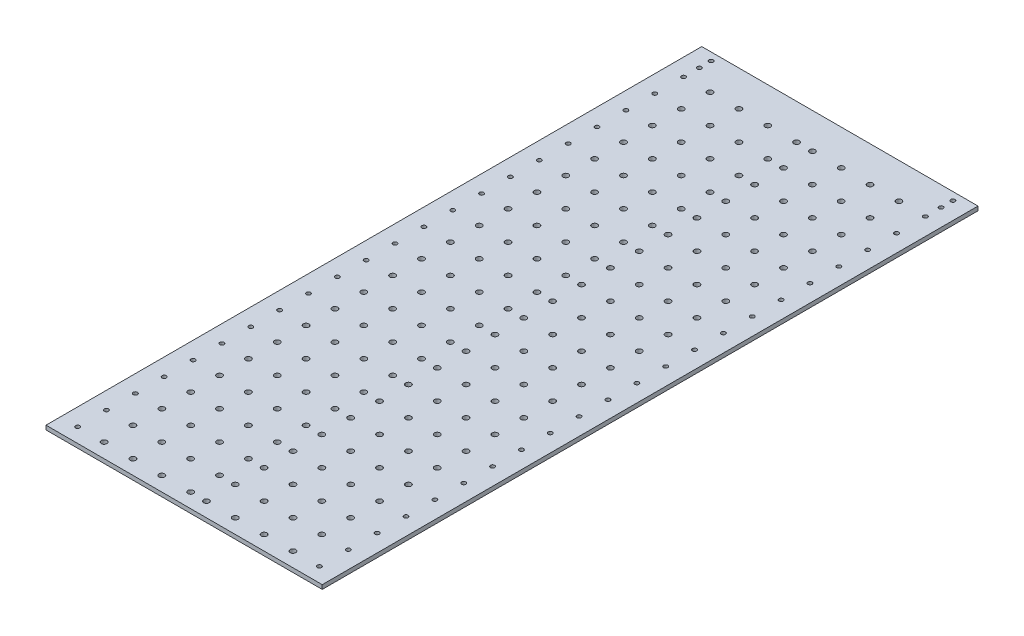
from build123d import *

# Parameters (mm, degrees)
SKETCH1_W           = 210.61
SKETCH1_H           = 500
SKETCH1_R           = 1.6
SKETCH1_R_2         = 2.125
BOSS_EXTRUDE1_DEPTH = 3.175


with BuildPart() as part:
    # Sketch1 → Boss-Extrude1 (new body)
    with BuildSketch(Plane(origin=(0, 0, 0), x_dir=(1, 0, 0), z_dir=(0, 1, 0))):
        Rectangle(SKETCH1_W, SKETCH1_H)
        with Locations((92.18, 244)):
            Circle(SKETCH1_R, mode=Mode.SUBTRACT)
        with Locations((92.18, 235)):
            Circle(SKETCH1_R, mode=Mode.SUBTRACT)
        with Locations((92.18, 223)):
            Circle(SKETCH1_R, mode=Mode.SUBTRACT)
        with Locations((92.18, 201)):
            Circle(SKETCH1_R, mode=Mode.SUBTRACT)
        with Locations((92.18, 179)):
            Circle(SKETCH1_R, mode=Mode.SUBTRACT)
        with Locations((92.18, 157)):
            Circle(SKETCH1_R, mode=Mode.SUBTRACT)
        with Locations((92.18, 135)):
            Circle(SKETCH1_R, mode=Mode.SUBTRACT)
        with Locations((92.18, 113)):
            Circle(SKETCH1_R, mode=Mode.SUBTRACT)
        with Locations((92.18, 91)):
            Circle(SKETCH1_R, mode=Mode.SUBTRACT)
        with Locations((92.18, 69)):
            Circle(SKETCH1_R, mode=Mode.SUBTRACT)
        with Locations((92.18, 47)):
            Circle(SKETCH1_R, mode=Mode.SUBTRACT)
        with Locations((92.18, 25)):
            Circle(SKETCH1_R, mode=Mode.SUBTRACT)
        with Locations((92.18, 3)):
            Circle(SKETCH1_R, mode=Mode.SUBTRACT)
        with Locations((92.18, -19)):
            Circle(SKETCH1_R, mode=Mode.SUBTRACT)
        with Locations((92.18, -41)):
            Circle(SKETCH1_R, mode=Mode.SUBTRACT)
        with Locations((92.18, -63)):
            Circle(SKETCH1_R, mode=Mode.SUBTRACT)
        with Locations((92.18, -85)):
            Circle(SKETCH1_R, mode=Mode.SUBTRACT)
        with Locations((92.18, -107)):
            Circle(SKETCH1_R, mode=Mode.SUBTRACT)
        with Locations((92.18, -129)):
            Circle(SKETCH1_R, mode=Mode.SUBTRACT)
        with Locations((92.18, -151)):
            Circle(SKETCH1_R, mode=Mode.SUBTRACT)
        with Locations((92.18, -173)):
            Circle(SKETCH1_R, mode=Mode.SUBTRACT)
        with Locations((92.18, -195)):
            Circle(SKETCH1_R, mode=Mode.SUBTRACT)
        with Locations((92.18, -217)):
            Circle(SKETCH1_R, mode=Mode.SUBTRACT)
        with Locations((92.18, -239)):
            Circle(SKETCH1_R, mode=Mode.SUBTRACT)
        with Locations((-92.18, 69)):
            Circle(SKETCH1_R, mode=Mode.SUBTRACT)
        with Locations((-92.18, 91)):
            Circle(SKETCH1_R, mode=Mode.SUBTRACT)
        with Locations((-92.18, 113)):
            Circle(SKETCH1_R, mode=Mode.SUBTRACT)
        with Locations((-92.18, 135)):
            Circle(SKETCH1_R, mode=Mode.SUBTRACT)
        with Locations((-92.18, 157)):
            Circle(SKETCH1_R, mode=Mode.SUBTRACT)
        with Locations((-92.18, 179)):
            Circle(SKETCH1_R, mode=Mode.SUBTRACT)
        with Locations((-92.18, 201)):
            Circle(SKETCH1_R, mode=Mode.SUBTRACT)
        with Locations((-92.18, 223)):
            Circle(SKETCH1_R, mode=Mode.SUBTRACT)
        with Locations((-92.18, 235)):
            Circle(SKETCH1_R, mode=Mode.SUBTRACT)
        with Locations((-92.18, -239)):
            Circle(SKETCH1_R, mode=Mode.SUBTRACT)
        with Locations((-92.18, -217)):
            Circle(SKETCH1_R, mode=Mode.SUBTRACT)
        with Locations((-92.18, -195)):
            Circle(SKETCH1_R, mode=Mode.SUBTRACT)
        with Locations((-92.18, -173)):
            Circle(SKETCH1_R, mode=Mode.SUBTRACT)
        with Locations((-92.18, -151)):
            Circle(SKETCH1_R, mode=Mode.SUBTRACT)
        with Locations((-92.18, -129)):
            Circle(SKETCH1_R, mode=Mode.SUBTRACT)
        with Locations((-92.18, -107)):
            Circle(SKETCH1_R, mode=Mode.SUBTRACT)
        with Locations((-92.18, -85)):
            Circle(SKETCH1_R, mode=Mode.SUBTRACT)
        with Locations((-92.18, -63)):
            Circle(SKETCH1_R, mode=Mode.SUBTRACT)
        with Locations((-92.18, -41)):
            Circle(SKETCH1_R, mode=Mode.SUBTRACT)
        with Locations((-92.18, -19)):
            Circle(SKETCH1_R, mode=Mode.SUBTRACT)
        with Locations((-92.18, 3)):
            Circle(SKETCH1_R, mode=Mode.SUBTRACT)
        with Locations((-92.18, 25)):
            Circle(SKETCH1_R, mode=Mode.SUBTRACT)
        with Locations((-92.18, 47)):
            Circle(SKETCH1_R, mode=Mode.SUBTRACT)
        with Locations((-92.18, 244)):
            Circle(SKETCH1_R, mode=Mode.SUBTRACT)
        with Locations((6, -239)):
            Circle(SKETCH1_R_2, mode=Mode.SUBTRACT)
        with Locations((28, -239)):
            Circle(SKETCH1_R_2, mode=Mode.SUBTRACT)
        with Locations((50, -239)):
            Circle(SKETCH1_R_2, mode=Mode.SUBTRACT)
        with Locations((72, -239)):
            Circle(SKETCH1_R_2, mode=Mode.SUBTRACT)
        with Locations((28, -217)):
            Circle(SKETCH1_R_2, mode=Mode.SUBTRACT)
        with Locations((50, -217)):
            Circle(SKETCH1_R_2, mode=Mode.SUBTRACT)
        with Locations((72, -217)):
            Circle(SKETCH1_R_2, mode=Mode.SUBTRACT)
        with Locations((28, -195)):
            Circle(SKETCH1_R_2, mode=Mode.SUBTRACT)
        with Locations((50, -195)):
            Circle(SKETCH1_R_2, mode=Mode.SUBTRACT)
        with Locations((72, -195)):
            Circle(SKETCH1_R_2, mode=Mode.SUBTRACT)
        with Locations((28, -173)):
            Circle(SKETCH1_R_2, mode=Mode.SUBTRACT)
        with Locations((50, -173)):
            Circle(SKETCH1_R_2, mode=Mode.SUBTRACT)
        with Locations((72, -173)):
            Circle(SKETCH1_R_2, mode=Mode.SUBTRACT)
        with Locations((28, -151)):
            Circle(SKETCH1_R_2, mode=Mode.SUBTRACT)
        with Locations((50, -151)):
            Circle(SKETCH1_R_2, mode=Mode.SUBTRACT)
        with Locations((72, -151)):
            Circle(SKETCH1_R_2, mode=Mode.SUBTRACT)
        with Locations((28, -129)):
            Circle(SKETCH1_R_2, mode=Mode.SUBTRACT)
        with Locations((50, -129)):
            Circle(SKETCH1_R_2, mode=Mode.SUBTRACT)
        with Locations((72, -129)):
            Circle(SKETCH1_R_2, mode=Mode.SUBTRACT)
        with Locations((28, -107)):
            Circle(SKETCH1_R_2, mode=Mode.SUBTRACT)
        with Locations((50, -107)):
            Circle(SKETCH1_R_2, mode=Mode.SUBTRACT)
        with Locations((72, -107)):
            Circle(SKETCH1_R_2, mode=Mode.SUBTRACT)
        with Locations((28, -85)):
            Circle(SKETCH1_R_2, mode=Mode.SUBTRACT)
        with Locations((50, -85)):
            Circle(SKETCH1_R_2, mode=Mode.SUBTRACT)
        with Locations((72, -85)):
            Circle(SKETCH1_R_2, mode=Mode.SUBTRACT)
        with Locations((28, -63)):
            Circle(SKETCH1_R_2, mode=Mode.SUBTRACT)
        with Locations((50, -63)):
            Circle(SKETCH1_R_2, mode=Mode.SUBTRACT)
        with Locations((72, -63)):
            Circle(SKETCH1_R_2, mode=Mode.SUBTRACT)
        with Locations((28, -41)):
            Circle(SKETCH1_R_2, mode=Mode.SUBTRACT)
        with Locations((50, -41)):
            Circle(SKETCH1_R_2, mode=Mode.SUBTRACT)
        with Locations((72, -41)):
            Circle(SKETCH1_R_2, mode=Mode.SUBTRACT)
        with Locations((28, -19)):
            Circle(SKETCH1_R_2, mode=Mode.SUBTRACT)
        with Locations((50, -19)):
            Circle(SKETCH1_R_2, mode=Mode.SUBTRACT)
        with Locations((72, -19)):
            Circle(SKETCH1_R_2, mode=Mode.SUBTRACT)
        with Locations((28, 3)):
            Circle(SKETCH1_R_2, mode=Mode.SUBTRACT)
        with Locations((50, 3)):
            Circle(SKETCH1_R_2, mode=Mode.SUBTRACT)
        with Locations((72, 3)):
            Circle(SKETCH1_R_2, mode=Mode.SUBTRACT)
        with Locations((28, 25)):
            Circle(SKETCH1_R_2, mode=Mode.SUBTRACT)
        with Locations((50, 25)):
            Circle(SKETCH1_R_2, mode=Mode.SUBTRACT)
        with Locations((72, 25)):
            Circle(SKETCH1_R_2, mode=Mode.SUBTRACT)
        with Locations((28, 47)):
            Circle(SKETCH1_R_2, mode=Mode.SUBTRACT)
        with Locations((50, 47)):
            Circle(SKETCH1_R_2, mode=Mode.SUBTRACT)
        with Locations((72, 47)):
            Circle(SKETCH1_R_2, mode=Mode.SUBTRACT)
        with Locations((28, 69)):
            Circle(SKETCH1_R_2, mode=Mode.SUBTRACT)
        with Locations((50, 69)):
            Circle(SKETCH1_R_2, mode=Mode.SUBTRACT)
        with Locations((72, 69)):
            Circle(SKETCH1_R_2, mode=Mode.SUBTRACT)
        with Locations((28, 91)):
            Circle(SKETCH1_R_2, mode=Mode.SUBTRACT)
        with Locations((50, 91)):
            Circle(SKETCH1_R_2, mode=Mode.SUBTRACT)
        with Locations((72, 91)):
            Circle(SKETCH1_R_2, mode=Mode.SUBTRACT)
        with Locations((28, 113)):
            Circle(SKETCH1_R_2, mode=Mode.SUBTRACT)
        with Locations((50, 113)):
            Circle(SKETCH1_R_2, mode=Mode.SUBTRACT)
        with Locations((72, 113)):
            Circle(SKETCH1_R_2, mode=Mode.SUBTRACT)
        with Locations((28, 135)):
            Circle(SKETCH1_R_2, mode=Mode.SUBTRACT)
        with Locations((50, 135)):
            Circle(SKETCH1_R_2, mode=Mode.SUBTRACT)
        with Locations((72, 135)):
            Circle(SKETCH1_R_2, mode=Mode.SUBTRACT)
        with Locations((28, 157)):
            Circle(SKETCH1_R_2, mode=Mode.SUBTRACT)
        with Locations((50, 157)):
            Circle(SKETCH1_R_2, mode=Mode.SUBTRACT)
        with Locations((72, 157)):
            Circle(SKETCH1_R_2, mode=Mode.SUBTRACT)
        with Locations((28, 179)):
            Circle(SKETCH1_R_2, mode=Mode.SUBTRACT)
        with Locations((50, 179)):
            Circle(SKETCH1_R_2, mode=Mode.SUBTRACT)
        with Locations((72, 179)):
            Circle(SKETCH1_R_2, mode=Mode.SUBTRACT)
        with Locations((28, 201)):
            Circle(SKETCH1_R_2, mode=Mode.SUBTRACT)
        with Locations((50, 201)):
            Circle(SKETCH1_R_2, mode=Mode.SUBTRACT)
        with Locations((72, 201)):
            Circle(SKETCH1_R_2, mode=Mode.SUBTRACT)
        with Locations((28, 223)):
            Circle(SKETCH1_R_2, mode=Mode.SUBTRACT)
        with Locations((50, 223)):
            Circle(SKETCH1_R_2, mode=Mode.SUBTRACT)
        with Locations((72, 223)):
            Circle(SKETCH1_R_2, mode=Mode.SUBTRACT)
        with Locations((6, -217)):
            Circle(SKETCH1_R_2, mode=Mode.SUBTRACT)
        with Locations((6, -195)):
            Circle(SKETCH1_R_2, mode=Mode.SUBTRACT)
        with Locations((6, -173)):
            Circle(SKETCH1_R_2, mode=Mode.SUBTRACT)
        with Locations((6, -151)):
            Circle(SKETCH1_R_2, mode=Mode.SUBTRACT)
        with Locations((6, -129)):
            Circle(SKETCH1_R_2, mode=Mode.SUBTRACT)
        with Locations((6, -107)):
            Circle(SKETCH1_R_2, mode=Mode.SUBTRACT)
        with Locations((6, -85)):
            Circle(SKETCH1_R_2, mode=Mode.SUBTRACT)
        with Locations((6, -63)):
            Circle(SKETCH1_R_2, mode=Mode.SUBTRACT)
        with Locations((6, -41)):
            Circle(SKETCH1_R_2, mode=Mode.SUBTRACT)
        with Locations((6, -19)):
            Circle(SKETCH1_R_2, mode=Mode.SUBTRACT)
        with Locations((6, 3)):
            Circle(SKETCH1_R_2, mode=Mode.SUBTRACT)
        with Locations((6, 25)):
            Circle(SKETCH1_R_2, mode=Mode.SUBTRACT)
        with Locations((6, 47)):
            Circle(SKETCH1_R_2, mode=Mode.SUBTRACT)
        with Locations((6, 69)):
            Circle(SKETCH1_R_2, mode=Mode.SUBTRACT)
        with Locations((6, 91)):
            Circle(SKETCH1_R_2, mode=Mode.SUBTRACT)
        with Locations((6, 113)):
            Circle(SKETCH1_R_2, mode=Mode.SUBTRACT)
        with Locations((6, 135)):
            Circle(SKETCH1_R_2, mode=Mode.SUBTRACT)
        with Locations((6, 157)):
            Circle(SKETCH1_R_2, mode=Mode.SUBTRACT)
        with Locations((6, 179)):
            Circle(SKETCH1_R_2, mode=Mode.SUBTRACT)
        with Locations((6, 201)):
            Circle(SKETCH1_R_2, mode=Mode.SUBTRACT)
        with Locations((6, 223)):
            Circle(SKETCH1_R_2, mode=Mode.SUBTRACT)
        with Locations((-6, 223)):
            Circle(SKETCH1_R_2, mode=Mode.SUBTRACT)
        with Locations((-6, 201)):
            Circle(SKETCH1_R_2, mode=Mode.SUBTRACT)
        with Locations((-6, 179)):
            Circle(SKETCH1_R_2, mode=Mode.SUBTRACT)
        with Locations((-6, 157)):
            Circle(SKETCH1_R_2, mode=Mode.SUBTRACT)
        with Locations((-6, 135)):
            Circle(SKETCH1_R_2, mode=Mode.SUBTRACT)
        with Locations((-6, 113)):
            Circle(SKETCH1_R_2, mode=Mode.SUBTRACT)
        with Locations((-6, 91)):
            Circle(SKETCH1_R_2, mode=Mode.SUBTRACT)
        with Locations((-6, 69)):
            Circle(SKETCH1_R_2, mode=Mode.SUBTRACT)
        with Locations((-6, 47)):
            Circle(SKETCH1_R_2, mode=Mode.SUBTRACT)
        with Locations((-6, 25)):
            Circle(SKETCH1_R_2, mode=Mode.SUBTRACT)
        with Locations((-6, 3)):
            Circle(SKETCH1_R_2, mode=Mode.SUBTRACT)
        with Locations((-6, -19)):
            Circle(SKETCH1_R_2, mode=Mode.SUBTRACT)
        with Locations((-6, -41)):
            Circle(SKETCH1_R_2, mode=Mode.SUBTRACT)
        with Locations((-6, -63)):
            Circle(SKETCH1_R_2, mode=Mode.SUBTRACT)
        with Locations((-6, -85)):
            Circle(SKETCH1_R_2, mode=Mode.SUBTRACT)
        with Locations((-6, -107)):
            Circle(SKETCH1_R_2, mode=Mode.SUBTRACT)
        with Locations((-6, -129)):
            Circle(SKETCH1_R_2, mode=Mode.SUBTRACT)
        with Locations((-6, -151)):
            Circle(SKETCH1_R_2, mode=Mode.SUBTRACT)
        with Locations((-6, -173)):
            Circle(SKETCH1_R_2, mode=Mode.SUBTRACT)
        with Locations((-6, -195)):
            Circle(SKETCH1_R_2, mode=Mode.SUBTRACT)
        with Locations((-6, -217)):
            Circle(SKETCH1_R_2, mode=Mode.SUBTRACT)
        with Locations((-72, 223)):
            Circle(SKETCH1_R_2, mode=Mode.SUBTRACT)
        with Locations((-50, 223)):
            Circle(SKETCH1_R_2, mode=Mode.SUBTRACT)
        with Locations((-28, 223)):
            Circle(SKETCH1_R_2, mode=Mode.SUBTRACT)
        with Locations((-72, 201)):
            Circle(SKETCH1_R_2, mode=Mode.SUBTRACT)
        with Locations((-50, 201)):
            Circle(SKETCH1_R_2, mode=Mode.SUBTRACT)
        with Locations((-28, 201)):
            Circle(SKETCH1_R_2, mode=Mode.SUBTRACT)
        with Locations((-72, 179)):
            Circle(SKETCH1_R_2, mode=Mode.SUBTRACT)
        with Locations((-50, 179)):
            Circle(SKETCH1_R_2, mode=Mode.SUBTRACT)
        with Locations((-28, 179)):
            Circle(SKETCH1_R_2, mode=Mode.SUBTRACT)
        with Locations((-72, 157)):
            Circle(SKETCH1_R_2, mode=Mode.SUBTRACT)
        with Locations((-50, 157)):
            Circle(SKETCH1_R_2, mode=Mode.SUBTRACT)
        with Locations((-28, 157)):
            Circle(SKETCH1_R_2, mode=Mode.SUBTRACT)
        with Locations((-72, 135)):
            Circle(SKETCH1_R_2, mode=Mode.SUBTRACT)
        with Locations((-50, 135)):
            Circle(SKETCH1_R_2, mode=Mode.SUBTRACT)
        with Locations((-28, 135)):
            Circle(SKETCH1_R_2, mode=Mode.SUBTRACT)
        with Locations((-72, 113)):
            Circle(SKETCH1_R_2, mode=Mode.SUBTRACT)
        with Locations((-50, 113)):
            Circle(SKETCH1_R_2, mode=Mode.SUBTRACT)
        with Locations((-28, 113)):
            Circle(SKETCH1_R_2, mode=Mode.SUBTRACT)
        with Locations((-72, 91)):
            Circle(SKETCH1_R_2, mode=Mode.SUBTRACT)
        with Locations((-50, 91)):
            Circle(SKETCH1_R_2, mode=Mode.SUBTRACT)
        with Locations((-28, 91)):
            Circle(SKETCH1_R_2, mode=Mode.SUBTRACT)
        with Locations((-72, 69)):
            Circle(SKETCH1_R_2, mode=Mode.SUBTRACT)
        with Locations((-50, 69)):
            Circle(SKETCH1_R_2, mode=Mode.SUBTRACT)
        with Locations((-28, 69)):
            Circle(SKETCH1_R_2, mode=Mode.SUBTRACT)
        with Locations((-72, 47)):
            Circle(SKETCH1_R_2, mode=Mode.SUBTRACT)
        with Locations((-50, 47)):
            Circle(SKETCH1_R_2, mode=Mode.SUBTRACT)
        with Locations((-28, 47)):
            Circle(SKETCH1_R_2, mode=Mode.SUBTRACT)
        with Locations((-72, 25)):
            Circle(SKETCH1_R_2, mode=Mode.SUBTRACT)
        with Locations((-50, 25)):
            Circle(SKETCH1_R_2, mode=Mode.SUBTRACT)
        with Locations((-28, 25)):
            Circle(SKETCH1_R_2, mode=Mode.SUBTRACT)
        with Locations((-72, 3)):
            Circle(SKETCH1_R_2, mode=Mode.SUBTRACT)
        with Locations((-50, 3)):
            Circle(SKETCH1_R_2, mode=Mode.SUBTRACT)
        with Locations((-28, 3)):
            Circle(SKETCH1_R_2, mode=Mode.SUBTRACT)
        with Locations((-72, -19)):
            Circle(SKETCH1_R_2, mode=Mode.SUBTRACT)
        with Locations((-50, -19)):
            Circle(SKETCH1_R_2, mode=Mode.SUBTRACT)
        with Locations((-28, -19)):
            Circle(SKETCH1_R_2, mode=Mode.SUBTRACT)
        with Locations((-72, -41)):
            Circle(SKETCH1_R_2, mode=Mode.SUBTRACT)
        with Locations((-50, -41)):
            Circle(SKETCH1_R_2, mode=Mode.SUBTRACT)
        with Locations((-28, -41)):
            Circle(SKETCH1_R_2, mode=Mode.SUBTRACT)
        with Locations((-72, -63)):
            Circle(SKETCH1_R_2, mode=Mode.SUBTRACT)
        with Locations((-50, -63)):
            Circle(SKETCH1_R_2, mode=Mode.SUBTRACT)
        with Locations((-28, -63)):
            Circle(SKETCH1_R_2, mode=Mode.SUBTRACT)
        with Locations((-72, -85)):
            Circle(SKETCH1_R_2, mode=Mode.SUBTRACT)
        with Locations((-50, -85)):
            Circle(SKETCH1_R_2, mode=Mode.SUBTRACT)
        with Locations((-28, -85)):
            Circle(SKETCH1_R_2, mode=Mode.SUBTRACT)
        with Locations((-72, -107)):
            Circle(SKETCH1_R_2, mode=Mode.SUBTRACT)
        with Locations((-50, -107)):
            Circle(SKETCH1_R_2, mode=Mode.SUBTRACT)
        with Locations((-28, -107)):
            Circle(SKETCH1_R_2, mode=Mode.SUBTRACT)
        with Locations((-72, -129)):
            Circle(SKETCH1_R_2, mode=Mode.SUBTRACT)
        with Locations((-50, -129)):
            Circle(SKETCH1_R_2, mode=Mode.SUBTRACT)
        with Locations((-28, -129)):
            Circle(SKETCH1_R_2, mode=Mode.SUBTRACT)
        with Locations((-72, -151)):
            Circle(SKETCH1_R_2, mode=Mode.SUBTRACT)
        with Locations((-50, -151)):
            Circle(SKETCH1_R_2, mode=Mode.SUBTRACT)
        with Locations((-28, -151)):
            Circle(SKETCH1_R_2, mode=Mode.SUBTRACT)
        with Locations((-72, -173)):
            Circle(SKETCH1_R_2, mode=Mode.SUBTRACT)
        with Locations((-50, -173)):
            Circle(SKETCH1_R_2, mode=Mode.SUBTRACT)
        with Locations((-28, -173)):
            Circle(SKETCH1_R_2, mode=Mode.SUBTRACT)
        with Locations((-72, -195)):
            Circle(SKETCH1_R_2, mode=Mode.SUBTRACT)
        with Locations((-50, -195)):
            Circle(SKETCH1_R_2, mode=Mode.SUBTRACT)
        with Locations((-28, -195)):
            Circle(SKETCH1_R_2, mode=Mode.SUBTRACT)
        with Locations((-72, -217)):
            Circle(SKETCH1_R_2, mode=Mode.SUBTRACT)
        with Locations((-50, -217)):
            Circle(SKETCH1_R_2, mode=Mode.SUBTRACT)
        with Locations((-28, -217)):
            Circle(SKETCH1_R_2, mode=Mode.SUBTRACT)
        with Locations((-72, -239)):
            Circle(SKETCH1_R_2, mode=Mode.SUBTRACT)
        with Locations((-50, -239)):
            Circle(SKETCH1_R_2, mode=Mode.SUBTRACT)
        with Locations((-28, -239)):
            Circle(SKETCH1_R_2, mode=Mode.SUBTRACT)
        with Locations((-6, -239)):
            Circle(SKETCH1_R_2, mode=Mode.SUBTRACT)
    extrude(amount=BOSS_EXTRUDE1_DEPTH)


solid = part.part
